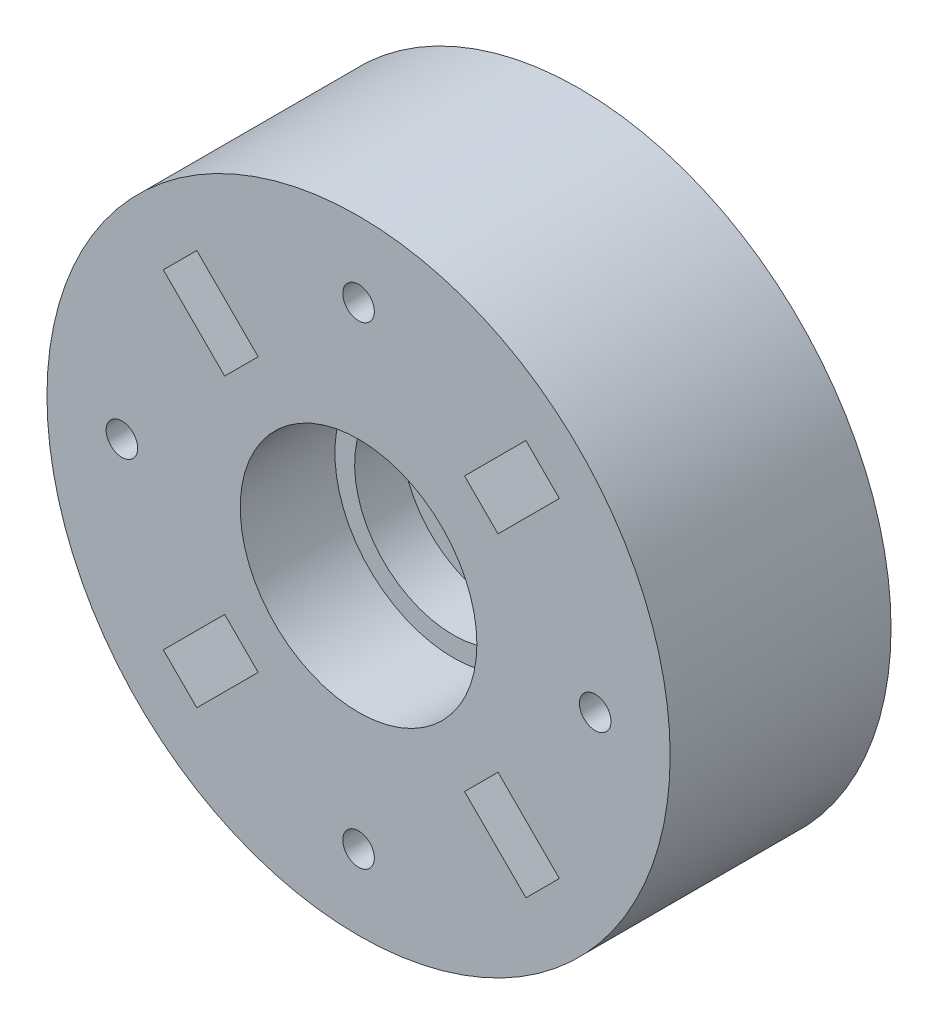
from build123d import *

# Parameters (mm, degrees)
CROQUIS1_R              = 39.5
CROQUIS1_R_2            = 12.5
CROQUIS1_R_3            = 2
SALIENTE_EXTRUIR1_DEPTH = 28
CROQUIS3_R              = 15
CORTAR_EXTRUIR1_DEPTH   = 12
CROQUIS5_R              = 16.857920318
SALIENTE_EXTRUIR2_DEPTH = 10
CROQUIS4_R              = 1.75
CORTAR_EXTRUIR2_DEPTH   = 10


with BuildPart() as part:
    # Croquis1 → Saliente-Extruir1 (new body)
    with BuildSketch(Plane.XY):
        Circle(CROQUIS1_R)
        Circle(CROQUIS1_R_2, mode=Mode.SUBTRACT)
        with Locations((0, 30)):
            Circle(CROQUIS1_R_3, mode=Mode.SUBTRACT)
        with Locations((30, 0)):
            Circle(CROQUIS1_R_3, mode=Mode.SUBTRACT)
        with Locations((0, -30)):
            Circle(CROQUIS1_R_3, mode=Mode.SUBTRACT)
        with Locations((-30, 0)):
            Circle(CROQUIS1_R_3, mode=Mode.SUBTRACT)
    extrude(amount=SALIENTE_EXTRUIR1_DEPTH)

    # Croquis3 → Cortar-Extruir1 (cut)
    with BuildSketch(Plane.XY.offset(28)):
        Circle(CROQUIS3_R)
        Polygon((17.67766953, 13.435028843), (25.455844123, 21.213203436), (21.213203436, 25.455844123), (13.435028843, 17.67766953), align=None)
        Polygon((13.435028843, -16.970562748), (21.213203436, -24.748737342), (25.455844123, -20.506096654), (17.67766953, -12.727922061), align=None)
        Polygon((-16.970562748, -12.727922061), (-24.748737342, -20.506096654), (-20.506096654, -24.748737342), (-12.727922061, -16.970562748), align=None)
        Polygon((-12.727922061, 17.67766953), (-20.506096654, 25.455844123), (-24.748737342, 21.213203436), (-16.970562748, 13.435028843), align=None)
    extrude(amount=-CORTAR_EXTRUIR1_DEPTH, mode=Mode.SUBTRACT)

    # Croquis5 → Saliente-Extruir2 (add)
    with BuildSketch(Plane(origin=(0, 0, 0), x_dir=(-1, 0, 0), z_dir=(0, 0, -1))):
        Circle(CROQUIS5_R)
    extrude(amount=-SALIENTE_EXTRUIR2_DEPTH)

    # Croquis4 → Cortar-Extruir2 (cut)
    with BuildSketch(Plane(origin=(0, 0, 0), x_dir=(-1, 0, 0), z_dir=(0, 0, -1))):
        with Locations((-12.727922061, -6.363961031)):
            Circle(CROQUIS4_R)
        with Locations((-6.363961031, -12.727922061)):
            Circle(CROQUIS4_R)
        with Locations((21.920310217, 28.284271247)):
            Circle(CROQUIS4_R)
        with Locations((28.284271247, 21.920310217)):
            Circle(CROQUIS4_R)
        Polygon((30, -3.5), (33.031088913, -1.75), (33.031088913, 1.75), (30, 3.5), (26.968911087, 1.75), (26.968911087, -1.75), align=None)
        Polygon((3.5, 30), (1.75, 33.031088913), (-1.75, 33.031088913), (-3.5, 30), (-1.75, 26.968911087), (1.75, 26.968911087), align=None)
        Polygon((-3.5, -30), (-1.75, -33.031088913), (1.75, -33.031088913), (3.5, -30), (1.75, -26.968911087), (-1.75, -26.968911087), align=None)
        Polygon((-30, 3.5), (-33.031088913, 1.75), (-33.031088913, -1.75), (-30, -3.5), (-26.968911087, -1.75), (-26.968911087, 1.75), align=None)
        Polygon((0.353553391, -13.788582233), (29.344931419, 15.202795796), (15.202795796, 29.344931419), (-13.788582233, 0.353553391), align=None)
    extrude(amount=-CORTAR_EXTRUIR2_DEPTH, mode=Mode.SUBTRACT)


solid = part.part
